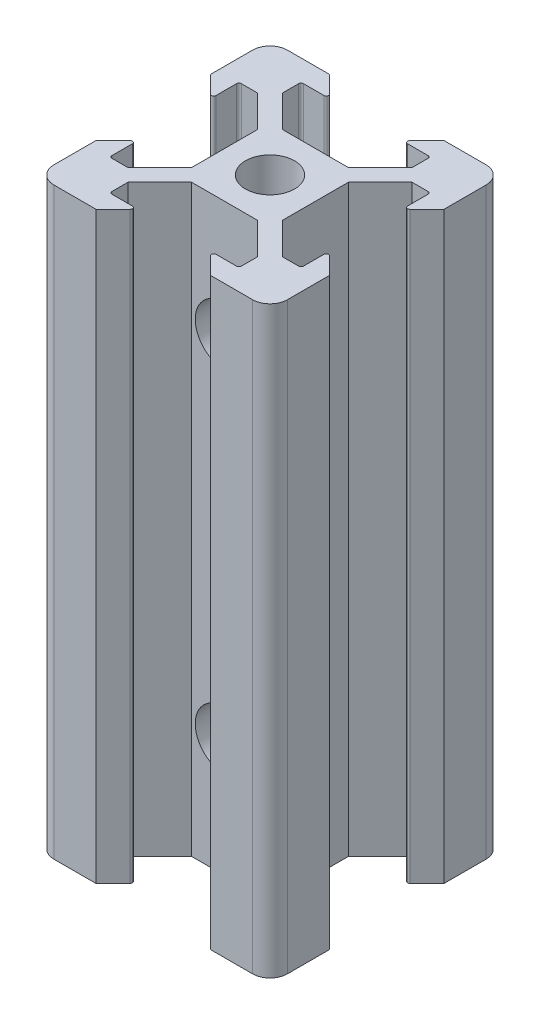
from build123d import *

# Parameters (mm, degrees)
SALIENTE_EXTRUIR1_OUTLINE_R = 2.1
SALIENTE_EXTRUIR1_DEPTH     = 50
REDONDEO1_R                 = 1.5
REDONDEO2_R                 = 0.2
CROQUIS2_R                  = 2.5
CORTAR_EXTRUIR1_DEPTH       = 55.772255751


# Read off the part's stored shape, not the designer's step: Saliente-Extruir1
with BuildPart() as part:
    # Saliente-Extruir1 outline → Saliente-Extruir1 (new body)
    with BuildSketch(Plane(origin=(0, 0, 0), x_dir=(1, 0, 0), z_dir=(0, 1, 0))):
        Polygon((-5.539339828, -6.6), (-2.84, -3.900660172), (2.84, -3.900660172), (5.539339828, -6.6), (5.539339828, -8.2), (3.1, -8.2), (4.9, -10), (10, -10), (10, -4.9), (8.2, -3.1), (8.2, -5.539339828), (6.6, -5.539339828), (3.900660172, -2.84), (3.900660172, 2.84), (6.6, 5.539339828), (8.2, 5.539339828), (8.2, 3.1), (10, 4.9), (10, 10), (4.9, 10), (3.1, 8.2), (5.539339828, 8.2), (5.539339828, 6.6), (2.84, 3.900660172), (-2.84, 3.900660172), (-5.539339828, 6.6), (-5.539339828, 8.2), (-3.1, 8.2), (-4.9, 10), (-10, 10), (-10, 4.9), (-8.2, 3.1), (-8.2, 5.539339828), (-6.6, 5.539339828), (-3.900660172, 2.84), (-3.900660172, -2.84), (-6.6, -5.539339828), (-8.2, -5.539339828), (-8.2, -3.1), (-10, -4.9), (-10, -10), (-4.9, -10), (-3.1, -8.2), (-5.539339828, -8.2), align=None)
        Circle(SALIENTE_EXTRUIR1_OUTLINE_R, mode=Mode.SUBTRACT)
    extrude(amount=SALIENTE_EXTRUIR1_DEPTH)

    # Redondeo1
    redondeo1_edges = [part.edges().sort_by_distance(p)[0] for p in [
        (-10, 25, 10),
        (-10, 25, -10),
        (10, 25, -10),
        (10, 25, 10),
    ]]
    fillet(redondeo1_edges, radius=REDONDEO1_R)

    # Redondeo2
    redondeo2_edges = [part.edges().sort_by_distance(p)[0] for p in [
        (-5.539339828, 25, 8.2),
        (-3.1, 25, 8.2),
        (-8.2, 25, 3.1),
        (-8.2, 25, 5.539339828),
        (-8.2, 25, -5.539339828),
        (-8.2, 25, -3.1),
        (-3.1, 25, -8.2),
        (-5.539339828, 25, -8.2),
        (5.539339828, 25, -8.2),
        (3.1, 25, -8.2),
        (8.2, 25, -3.1),
        (8.2, 25, -5.539339828),
        (8.2, 25, 5.539339828),
        (8.2, 25, 3.1),
        (3.1, 25, 8.2),
        (5.539339828, 25, 8.2),
    ]]
    fillet(redondeo2_edges, radius=REDONDEO2_R)

    # Croquis2 → Cortar-Extruir1 (cut, through all)
    with BuildSketch(Plane(origin=(0, 0, -10), x_dir=(-1, 0, 0), z_dir=(0, 0, -1))):
        with Locations((0, 40)):
            Circle(CROQUIS2_R)
        with Locations((0, 10)):
            Circle(CROQUIS2_R)
    extrude(amount=-CORTAR_EXTRUIR1_DEPTH, mode=Mode.SUBTRACT)


solid = part.part
